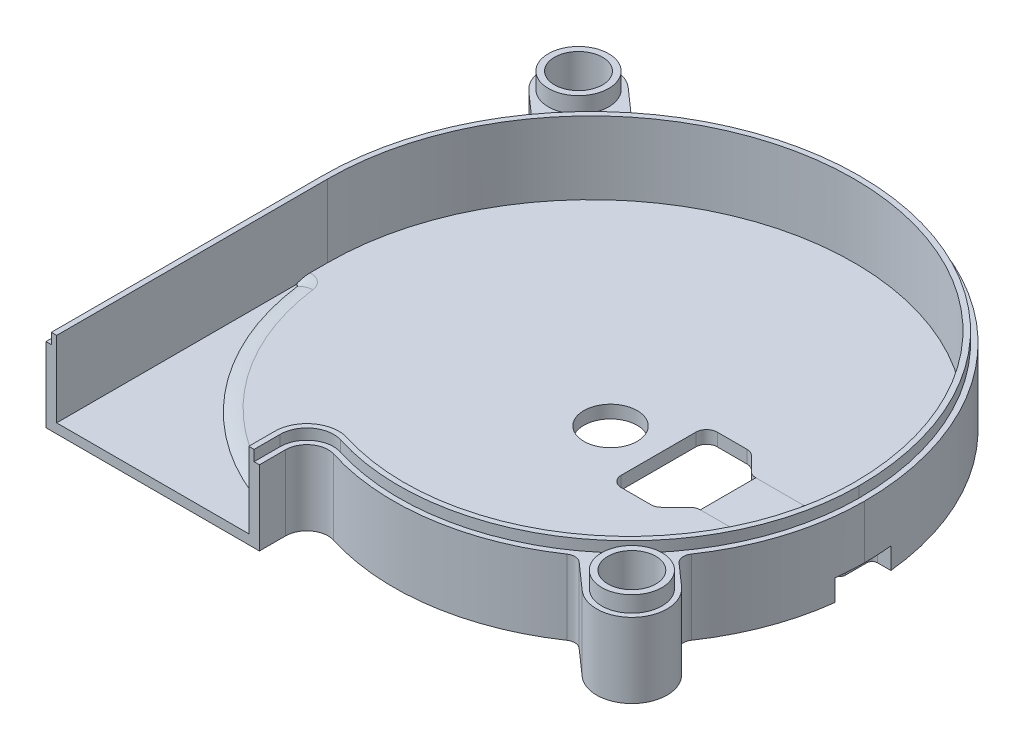
from build123d import *

# Parameters (mm, degrees)
SKETCH_1_R          = 2.25
SKETCH_1_R_2        = 2.5
EXTRUDE_1_DEPTH     = 8
CUT_EXTRUDE_1_DEPTH = 6.8
SKETCH_3_OUTSIDE_W  = 67.866
SKETCH_3_OUTSIDE_H  = 67.633
CUT_EXTRUDE_4_DEPTH = 1
SKETCH_5_R          = 2.825
SKETCH_5_R_2        = 2.25
EXTRUDE_2_DEPTH     = 1.5
CUT_EXTRUDE_5_DEPTH = 0.5
CUT_EXTRUDE_6_DEPTH = 2
FILLET_1_R          = 1
SKETCH_8_W          = 2.5
SKETCH_8_H          = 0.8
EXTRUDE_4_DEPTH     = 3
FILLET_2_R          = 0.5
CUT_EXTRUDE_7_DEPTH = 0.3
FILLET_3_R          = 0.1
FILLET_4_R          = 3
SKETCH_10_W         = 4.5
SKETCH_10_H         = 5.2
EXTRUDE_5_DEPTH     = 0.5


with BuildPart() as part:
    # Эскиз1 → Бобышка-Вытянуть1 (new body)
    with BuildSketch(Plane(origin=(0, 0, 0), x_dir=(1, 0, 0), z_dir=(0, 1, 0))):
        with BuildLine():
            Line((-27.5, -25.4), (-7.5, -25.4))
            Line((-7.5, -25.4), (-7.5, -22.955849111))
            ThreePointArc((-7.5, -22.955849111), (-6.68281162, -21.343100938), (-4.899043329, -21.048271831))
            ThreePointArc((-4.899043329, -21.048271831), (4.948796089, -21.832347138), (14.151976117, -18.241220202))
            ThreePointArc((14.151976117, -18.241220202), (14.777726241, -18.069792078), (15.376980036, -18.318480053))
            Line((15.376980036, -18.318480053), (17.814747272, -20.472785982))
            ThreePointArc((17.814747272, -20.472785982), (22.472785982, -20.185252728), (22.185252728, -15.527214018))
            Line((22.185252728, -15.527214018), (20.143734708, -13.723081814))
            ThreePointArc((20.143734708, -13.723081814), (19.813719174, -13.098302749), (19.979075206, -12.411340949))
            ThreePointArc((19.979075206, -12.411340949), (22.823148445, -6.493089604), (23.8, 0))
            ThreePointArc((23.8, 0), (9.576401492, 22.98111988), (-17.333078903, 20.466663618))
            ThreePointArc((-17.333078903, 20.466663618), (-17.974550182, 20.264645495), (-18.598905377, 20.514600122))
            Line((-18.598905377, 20.514600122), (-20.814747272, 22.472785982))
            ThreePointArc((-20.814747272, 22.472785982), (-25.472785982, 22.185252728), (-25.185252728, 17.527214018))
            Line((-25.185252728, 17.527214018), (-23.20688118, 15.778885673))
            ThreePointArc((-23.20688118, 15.778885673), (-22.876796583, 15.153555184), (-23.04284729, 14.466226133))
            ThreePointArc((-23.04284729, 14.466226133), (-26.362874376, 7.569397218), (-27.5, 0))
            Line((-27.5, 0), (-27.5, -25.4))
        make_face()
        with Locations(Location((-23, 20, 0), (0, 0, 270))):
            Circle(SKETCH_1_R, mode=Mode.SUBTRACT)
        with Locations(Location((20, -18, 0), (0, 0, 270))):
            Circle(SKETCH_1_R, mode=Mode.SUBTRACT)
        with Locations(Location((0, 0, 0), (0, 0, 270))):
            Circle(SKETCH_1_R_2, mode=Mode.SUBTRACT)
    extrude(amount=EXTRUDE_1_DEPTH)

    # Эскиз2 → Вырез-Вытянуть1 (cut)
    with BuildSketch(Plane(origin=(0, 8, 0), x_dir=(1, 0, 0), z_dir=(0, 1, 0))):
        with BuildLine():
            Line((-8.5, -25.4), (-8.5, -22.955849111))
            ThreePointArc((-8.5, -22.955849111), (-7.274217431, -20.536726851), (-4.598564994, -20.094483191))
            ThreePointArc((-4.598564994, -20.094483191), (4.803026036, -20.843028639), (13.589169994, -17.414631267))
            ThreePointArc((13.589169994, -17.414631267), (16.632858543, -14.893819788), (19.152217909, -11.84892917))
            ThreePointArc((19.152217909, -11.84892917), (21.867461922, -6.198703298), (22.799999997, 0.000326884))
            ThreePointArc((22.799999997, 0.000326884), (9.131074658, 22.085751778), (-16.729450225, 19.669398029))
            ThreePointArc((-16.729450225, 19.669398029), (-19.707335368, 17.009099388), (-22.216615604, 13.902895678))
            ThreePointArc((-22.216615604, 13.902895678), (-25.407255169, 7.27479247), (-26.500000107, 0.000327424))
            Line((-26.500000107, 0.000327424), (-26.5, -25.4))
            Line((-26.5, -25.4), (-8.5, -25.4))
        make_face()
    extrude(amount=-CUT_EXTRUDE_1_DEPTH, mode=Mode.SUBTRACT)

    # Эскиз3 outside → Вырез-Вытянуть4 (cut)
    with BuildSketch(Plane(origin=(0, 8, 0), x_dir=(1, 0, 0), z_dir=(0, 1, 0))):
        with Locations((-1.85, 0.1335)):
            Rectangle(SKETCH_3_OUTSIDE_W, SKETCH_3_OUTSIDE_H)
        with BuildLine():
            Line((-8, -25.4), (-8, -22.955849111))
            ThreePointArc((-8, -22.955849111), (-6.978514526, -20.939913894), (-4.748804162, -20.571377511))
            ThreePointArc((-4.748804162, -20.571377511), (14.487462515, -17.39189423), (23.3, 0.000122694))
            ThreePointArc((23.3, 0.000122694), (-1.849981151, 25.166802402), (-26.999999983, 0.000160392))
            Line((-26.999999983, 0.000160392), (-27.000000053, -25.4))
            Line((-27.000000053, -25.4), (-8, -25.4))
        make_face(mode=Mode.SUBTRACT)
    extrude(amount=-CUT_EXTRUDE_4_DEPTH, mode=Mode.SUBTRACT)

    # Эскиз5 → Бобышка-Вытянуть2 (add)
    # profile 1 of 2: a face of its own
    with BuildSketch(Plane(origin=(0, 7, 0), x_dir=(1, 0, 0), z_dir=(0, 1, 0))):
        with Locations(Location((20, -18, 0), (0, 0, 270))):
            Circle(SKETCH_5_R)
        with Locations(Location((20, -18, 0), (0, 0, 270))):
            Circle(SKETCH_5_R_2, mode=Mode.SUBTRACT)
    # profile 2 of 2: a face of its own
    with BuildSketch(Plane(origin=(0, 7, 0), x_dir=(1, 0, 0), z_dir=(0, 1, 0))):
        with Locations(Location((-23, 20, 0), (0, 0, 270))):
            Circle(SKETCH_5_R)
        with Locations(Location((-23, 20, 0), (0, 0, 270))):
            Circle(SKETCH_5_R_2, mode=Mode.SUBTRACT)
    extrude(amount=EXTRUDE_2_DEPTH)

    # Эскиз6 → Вырез-Вытянуть5 (cut)
    with BuildSketch(Plane.XZ):
        with BuildLine():
            Line((-8.124359088, -8.831465869), (-12.079320344, -12.786427125))
            Line((-12.079320344, -12.786427125), (-15.112213356, -15.819320137))
            ThreePointArc((-15.112213356, -15.819320137), (-8.444967684, -20.565662067), (-0.5, -22.529692378))
            Line((-0.5, -22.529692378), (-0.5, -18.690864606))
            Line((-0.5, -18.690864606), (-0.5, -11.989578808))
            ThreePointArc((-0.5, -11.989578808), (-4.592201188, -11.08655439), (-8.124359088, -8.831465869))
        make_face()
        with BuildLine():
            Line((-15.787974775, -15.080867994), (-12.786427125, -12.079320344))
            Line((-12.786427125, -12.079320344), (-8.831465869, -8.124359088))
            ThreePointArc((-8.831465869, -8.124359088), (-11.08655439, -4.592201188), (-11.989578808, -0.5))
            Line((-11.989578808, -0.5), (-19.679374583, -0.5))
            Line((-19.679374583, -0.5), (-21.191246789, -0.5))
            ThreePointArc((-21.191246789, -0.5), (-19.828810643, -8.286704941), (-15.787974775, -15.080867994))
        make_face()
        with BuildLine():
            Line((-21.159916823, 0.5), (-19.679374583, 0.5))
            Line((-19.679374583, 0.5), (-11.989578808, 0.5))
            ThreePointArc((-11.989578808, 0.5), (-11.08655439, 4.592201188), (-8.831465869, 8.124359088))
            Line((-8.831465869, 8.124359088), (-11.509243088, 10.802136307))
            Line((-11.509243088, 10.802136307), (-15.133940377, 14.426833596))
            ThreePointArc((-15.133940377, 14.426833596), (-19.393122123, 8.00263002), (-21.159916823, 0.5))
        make_face()
        with BuildLine():
            Line((-14.426833596, 15.133940377), (-10.802136307, 11.509243088))
            Line((-10.802136307, 11.509243088), (-8.124359088, 8.831465869))
            ThreePointArc((-8.124359088, 8.831465869), (-4.592201188, 11.08655439), (-0.5, 11.989578808))
            Line((-0.5, 11.989578808), (-0.5, 17.569097793))
            Line((-0.5, 17.569097793), (-0.5, 21.159916823))
            ThreePointArc((-0.5, 21.159916823), (-8.00263002, 19.393122123), (-14.426833596, 15.133940377))
        make_face()
        with BuildLine():
            Line((0.5, 21.191246789), (0.5, 17.569097793))
            Line((0.5, 17.569097793), (0.5, 11.989578808))
            ThreePointArc((0.5, 11.989578808), (4.592201188, 11.08655439), (8.124359088, 8.831465869))
            Line((8.124359088, 8.831465869), (11.227255938, 11.93436272))
            Line((11.227255938, 11.93436272), (15.080867994, 15.787974775))
            ThreePointArc((15.080867994, 15.787974775), (8.286704941, 19.828810643), (0.5, 21.191246789))
        make_face()
        with BuildLine():
            Line((11.522911958, 3.35), (18.148882908, 3.35))
            Line((18.148882908, 3.35), (22.186495338, 3.35))
            ThreePointArc((22.186495338, 3.35), (19.923839699, 9.729629785), (15.819320137, 15.112213356))
            Line((15.819320137, 15.112213356), (11.93436272, 11.227255938))
            Line((11.93436272, 11.227255938), (8.831465869, 8.124359088))
            ThreePointArc((8.831465869, 8.124359088), (10.453410944, 5.892893995), (11.522911958, 3.35))
        make_face()
        with BuildLine():
            Line((8.831465869, -8.124359088), (10.382914295, -9.675807513))
            Line((10.382914295, -9.675807513), (16.503715933, -15.796609151))
            ThreePointArc((16.503715933, -15.796609151), (20.456263822, -10.049295735), (22.398860789, -3.35))
            Line((22.398860789, -3.35), (18.148882908, -3.35))
            Line((18.148882908, -3.35), (11.522911958, -3.35))
            ThreePointArc((11.522911958, -3.35), (10.453410944, -5.892893995), (8.831465869, -8.124359088))
        make_face()
        with BuildLine():
            Line((0.5, -11.989578808), (0.5, -18.690864606))
            Line((0.5, -18.690864606), (0.5, -22.561022344))
            ThreePointArc((0.5, -22.561022344), (8.739410144, -21.025097131), (15.796609151, -16.503715933))
            Line((15.796609151, -16.503715933), (9.675807513, -10.382914295))
            Line((9.675807513, -10.382914295), (8.124359088, -8.831465869))
            ThreePointArc((8.124359088, -8.831465869), (4.592201188, -11.08655439), (0.5, -11.989578808))
        make_face()
    extrude(amount=-CUT_EXTRUDE_5_DEPTH, mode=Mode.SUBTRACT)

    # Эскиз7 → Вырез-Вытянуть6 (cut)
    with BuildSketch(Plane.XZ):
        with BuildLine():
            Line((23.669597249, -2.6), (10.6, -2.6))
            Line((10.6, -2.6), (8.7, -4.5))
            Line((8.7, -4.5), (4.5, -4.5))
            Line((4.5, -4.5), (4.5, 4.5))
            Line((4.5, 4.5), (8.7, 4.5))
            Line((8.7, 4.5), (10.6, 2.6))
            Line((10.6, 2.6), (23.646302286, 2.6))
            ThreePointArc((23.646302286, 2.6), (23.761542061, 1.30226946), (23.8, 0))
            ThreePointArc((23.8, 0), (23.767804759, -1.30165542), (23.669597249, -2.6))
        make_face()
    extrude(amount=-CUT_EXTRUDE_6_DEPTH, mode=Mode.SUBTRACT)

    # Скругление1
    fillet_1_edges = [part.edges().sort_by_distance(p)[0] for p in [
        (10.6, 0.6, -2.6),
        (8.7, 0.6, -4.5),
        (4.5, 0.6, -4.5),
        (4.5, 0.6, 4.5),
        (8.7, 0.6, 4.5),
        (10.6, 0.6, 2.6),
    ]]
    fillet(fillet_1_edges, radius=FILLET_1_R)

    # Эскиз8 → Бобышка-Вытянуть4 (add)
    with BuildSketch(Plane.XY.offset(-2.6)):
        with Locations((20.669597249, 0.4)):
            Rectangle(SKETCH_8_W, SKETCH_8_H)
    extrude(amount=EXTRUDE_4_DEPTH)

    # Скругление2
    fillet_2_edges = [part.edges().sort_by_distance(p)[0] for p in [
        (21.919597249, 0.4, -2.6),
        (19.419597249, 0.4, -2.6),
        (21.919597249, 0.4, 0.4),
        (19.419597249, 0.4, 0.4),
    ]]
    fillet(fillet_2_edges, radius=FILLET_2_R)

    # Эскиз9 → Вырез-Вытянуть7 (cut)
    with BuildSketch(Plane(origin=(0, 1.2, 0), x_dir=(1, 0, 0), z_dir=(0, 1, 0))):
        with BuildLine():
            Line((-8.5, -22.955849111), (-8.5, -25.4))
            Line((-8.5, -25.4), (-26.500000053, -25.4))
            Line((-26.500000053, -25.4), (-26.500000053, 0.000327424))
            ThreePointArc((-26.500000053, 0.000327424), (-21.459149206, -14.582140414), (-8.5, -22.955849111))
        make_face()
    extrude(amount=-CUT_EXTRUDE_7_DEPTH, mode=Mode.SUBTRACT)

    # Скругление3
    fillet_3_edges = [part.edges().sort_by_distance(p)[0] for p in [
        (-26.500000053, 1.05, -0.000327424),
    ]]
    fillet(fillet_3_edges, radius=FILLET_3_R)

    # Скругление4
    # the kernel refuses this fillet: 3 mm, written as the material it takes off along each edge
    with BuildSketch(Plane(origin=(-26.400000053, 1.2, 3.060180663), x_dir=(0.9923757765688515, 0, -0.12324900843158587), z_dir=(-0.12324900843158587, 0, -0.9923757765688515))) as fillet_4_piece_1_section:
        with BuildLine():
            CenterArc((-1.407669683, 3), FILLET_4_R, 270, 25.841932763)
            Line((-0.1, 0.3), (-0.1, 0))
            Line((-0.1, 0), (-1.407669683, 0))
        make_face()
    fillet_4_piece_1 = revolve(axis=Axis((-26.400000053, 1.2, 3.060180663), (0, -1, 0)), revolution_arc=359.64, mode=Mode.PRIVATE)
    fillet_4_piece_1 = split(fillet_4_piece_1, bisect_by=Plane(origin=(-26.500000097, 1.12988638, 2.326222559), z_dir=(1.0, 0, -4.220683577170919e-09)), keep=Keep.TOP, mode=Mode.PRIVATE)
    add(fillet_4_piece_1, mode=Mode.SUBTRACT)
    with BuildSketch(Plane(origin=(-2.841339444, 1.2, -0.01613453), x_dir=(-0.9915817966570438, 0, 0.12948181547379184), z_dir=(-0.12948181547379184, 0, -0.9915817966570438))) as fillet_4_piece_2_section:
        with BuildLine():
            CenterArc((22.350996206, -3), FILLET_4_R, 64.158067237, 25.841932763)
            Line((23.658665889, -0.3), (23.658665889, 0))
            Line((23.658665889, 0), (22.350996206, 0))
        make_face()
    fillet_4_piece_2 = revolve(axis=Axis((-2.841339444, 1.2, -0.01613453), (0, 1, 0)), revolution_arc=76.641282735, mode=Mode.PRIVATE)
    fillet_4_piece_2 = fillet_4_piece_2 - Plane(origin=(-5.5, 1.12988638, 22.955849111), x_dir=(-1, 0, 0), z_dir=(0, 1, 0)) * Cylinder(3, 95, mode=Mode.PRIVATE)
    add(fillet_4_piece_2, mode=Mode.SUBTRACT)


with BuildPart() as body_2:
    # Эскиз10 → Бобышка-Вытянуть5 (new body)
    with BuildSketch(Plane(origin=(0, 1.2, 0), x_dir=(1, 0, 0), z_dir=(0, 1, 0))):
        with Locations((13.264213562, 0)):
            Rectangle(SKETCH_10_W, SKETCH_10_H)
    extrude(amount=-EXTRUDE_5_DEPTH)


solid = Compound([part.part, body_2.part])
